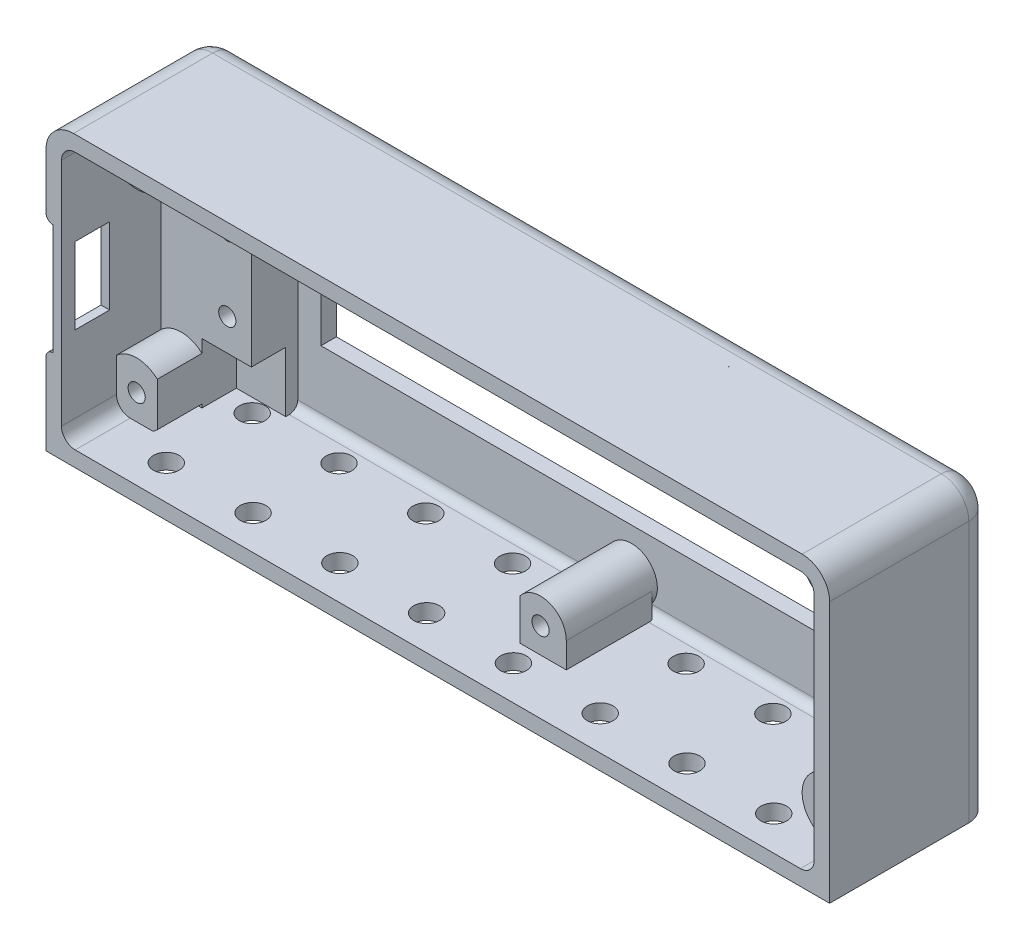
from build123d import *
from build123d.topology import SkipClean

# Parameters (mm, degrees)
SKETCH_2_W             = 87.6
SKETCH_2_H             = 30
SKETCH_2_W_2           = 61.2
SKETCH_2_H_2           = 14.6
EXTRUDE_1_DEPTH        = 1.8
EXTRUDE_1_2_DEPTH      = 17
EXTRUDE_1_2_DEPTH_BACK = 1.8
SKETCH_3_W             = 91.2
SKETCH_3_H             = 33.6
SKETCH_3_W_2           = 87.6
SKETCH_3_H_2           = 30
SKETCH_4_W             = 10.5
SKETCH_4_H             = 30
SKETCH_4_W_2           = 6.9
EXTRUDE_2_DEPTH        = 5.4
SKETCH_5_R             = 1
CUT_EXTRUDE_1_DEPTH    = 5.4
FILLET_2_R             = 1
FILLET_5_R             = 1.6
FILLET_6_R             = 3.2
FILLET_7_R             = 2.6
SKETCH_8_R             = 3
SKETCH_8_R_2           = 3.5
EXTRUDE_3_DEPTH        = 10.6
SKETCH_9_W             = 6
SKETCH_9_H             = 3.046171036
SKETCH_9_H_2           = 2.953828964
EXTRUDE_4_DEPTH        = 10
SKETCH_10_R            = 1
CUT_EXTRUDE_2_DEPTH    = 10.6
EXTRUDE_START          = 1.6
SKETCH_11_R            = 1
EXTRUDE_5_DEPTH        = 1.6
SKETCH_12_W            = 4
SKETCH_12_H            = 8.9
CUT_EXTRUDE_3_DEPTH    = 2
SKETCH_13_W            = 7.2
SKETCH_13_H            = 12.9
CUT_EXTRUDE_4_DEPTH    = 0.8
FILLET_8_R             = 0.8
SKETCH_14_W            = 42.2
SKETCH_14_H            = 7
CUT_EXTRUDE_5_DEPTH    = 10.8
SKETCH_15_W            = 3
SKETCH_15_H            = 16.8
EXTRUDE_6_DEPTH        = 2
CHAMFER_START          = -44.4
CHAMFER_2_DEPTH        = 85.2
CHAMFER_2_2_DEPTH      = 3
CHAMFER_START_2        = 37.8
CHAMFER_2_3_DEPTH      = 3
SKETCH_16_R            = 1.5
CUT_EXTRUDE_6_DEPTH    = 1.8


with BuildPart() as part:
    # Эскиз2 → Extrude 1 (new body)
    with BuildSketch(Plane.XY):
        with Locations((-1.8, 0)):
            Rectangle(SKETCH_2_W, SKETCH_2_H)
        with Locations((-1.8, 0.1)):
            Rectangle(SKETCH_2_W_2, SKETCH_2_H_2, mode=Mode.SUBTRACT)
    extrude(amount=EXTRUDE_1_DEPTH)

    # Эскиз3 → Extrude 1 2 (add, two sides: drawn at the far end of the back side and taken through both)
    with BuildSketch(Plane.XY.offset(1.8).offset(-EXTRUDE_1_2_DEPTH_BACK)):
        with Locations((-1.8, 0)):
            Rectangle(SKETCH_3_W, SKETCH_3_H)
        with Locations((-1.8, 0)):
            Rectangle(SKETCH_3_W_2, SKETCH_3_H_2, mode=Mode.SUBTRACT)
    extrude(amount=EXTRUDE_1_2_DEPTH + EXTRUDE_1_2_DEPTH_BACK)

    # Эскиз4 → Бобышка-Вытянуть2 (add)
    with BuildSketch(Plane.XY.offset(1.8)):
        with Locations((-40.35, 0)):
            Rectangle(SKETCH_4_W, SKETCH_4_H)
        with Locations((38.55, 0)):
            Rectangle(SKETCH_4_W_2, SKETCH_4_H)
    extrude(amount=EXTRUDE_2_DEPTH)

    # Эскиз5 → Вырез-Вытянуть1 (cut)
    with BuildSketch(Plane.XY.offset(7.2)):
        with Locations((-37.9, 4.3)):
            Circle(SKETCH_5_R)
        with Locations((-37.9, -4.3)):
            Circle(SKETCH_5_R)
        with Locations((37.9, 4.3)):
            Circle(SKETCH_5_R)
        with Locations((37.9, -4.3)):
            Circle(SKETCH_5_R)
    extrude(amount=-CUT_EXTRUDE_1_DEPTH, mode=Mode.SUBTRACT)

    # Скругление2
    fillet_2_edges = [part.edges().sort_by_distance(p)[0] for p in [
        (0, -15, 1.8),
        (0, 15, 1.8),
    ]]
    fillet(fillet_2_edges, radius=FILLET_2_R)

    # Скругление5
    fillet_5_edges = [part.edges().sort_by_distance(p)[0] for p in [
        (-45.6, 15, 13),
        (-45.6, -15, 13),
        (42, -15, 13),
        (42, 15, 13),
    ]]
    fillet(fillet_5_edges, radius=FILLET_5_R)

    # Скругление6
    fillet_6_edges = [part.edges().sort_by_distance(p)[0] for p in [
        (-47.4, 16.8, 9.4),
        (43.8, 16.8, 9.4),
    ]]
    fillet(fillet_6_edges, radius=FILLET_6_R)

    # Скругление7
    fillet_7_edges = [part.edges().sort_by_distance(p)[0] for p in [
        (-1.8, 16.8, 0),
        (-47.4, -1.6, 0),
        (42.8627417, 15.8627417, 0),
        (-46.4627417, 15.8627417, 0),
        (43.8, -1.6, 0),
    ]]
    fillet(fillet_7_edges, radius=FILLET_7_R)

    # Эскиз8 → Бобышка-Вытянуть3 (add)
    with BuildSketch(Plane.XY.offset(1.8)):
        with Locations(Location((3.75345012, 11.953828964, 0), (0, 0, 136.995404907))):
            Circle(SKETCH_8_R)
        with Locations((3.75345012, -12.046171036)):
            Circle(SKETCH_8_R)
        with Locations((-43.24654988, 11.953828964)):
            Circle(SKETCH_8_R_2)
        with Locations((-43.24654988, -12.046171036)):
            Circle(SKETCH_8_R_2)
        with Locations((39.3, 11.953828964)):
            Circle(SKETCH_8_R_2)
        with Locations((39.3, -12.046171036)):
            Circle(SKETCH_8_R_2)
    extrude(amount=EXTRUDE_3_DEPTH)

    # Эскиз9 → Бобышка-Вытянуть4 (add)
    with BuildSketch(Plane.XY.offset(12.4)):
        with Locations((3.75345012, 13.476914482)):
            Rectangle(SKETCH_9_W, SKETCH_9_H)
        with Locations((3.75345012, -13.523085518)):
            Rectangle(SKETCH_9_W, SKETCH_9_H_2)
    extrude(amount=-EXTRUDE_4_DEPTH)

    # Эскиз10 → Вырез-Вытянуть2 (cut)
    with BuildSketch(Plane.XY.offset(12.4)):
        with Locations((3.75345012, 11.953828964)):
            Circle(SKETCH_10_R)
        with Locations((3.75345012, -12.046171036)):
            Circle(SKETCH_10_R)
        with Locations((-43.24654988, 11.953828964)):
            Circle(SKETCH_10_R)
        with Locations((-43.24654988, -12.046171036)):
            Circle(SKETCH_10_R)
        with Locations((39.3, 11.953828964)):
            Circle(SKETCH_10_R)
        with Locations((39.3, -12.046171036)):
            Circle(SKETCH_10_R)
    extrude(amount=-CUT_EXTRUDE_2_DEPTH, mode=Mode.SUBTRACT)

    # Эскиз11 → Бобышка-Вытянуть5 (add)
    # profile 1 of 2: a face of its own
    with SkipClean():  # the faces are left unmerged after this step: merging them gives an invalid solid
        with BuildSketch(Plane.XY.offset(12.4).offset(EXTRUDE_START)):
            with BuildLine():
                Line((40.4, 15), (37.576386929, 15))
                ThreePointArc((37.576386929, 15), (36.618546129, 9.704427902), (42, 9.726723219))
                Line((42, 9.726723219), (42, 13.4))
                ThreePointArc((42, 13.4), (41.53137085, 14.53137085), (40.4, 15))
            make_face()
            with Locations((39.3, 11.953828964)):
                Circle(SKETCH_11_R, mode=Mode.SUBTRACT)
        # profile 2 of 2: a face of its own
        with BuildSketch(Plane.XY.offset(12.4).offset(EXTRUDE_START)):
            with BuildLine():
                Line((42, -13.4), (42, -9.819065291))
                ThreePointArc((42, -9.819065291), (36.677089418, -9.728771615), (37.422529773, -15))
                Line((37.422529773, -15), (40.4, -15))
                ThreePointArc((40.4, -15), (41.53137085, -14.53137085), (42, -13.4))
            make_face()
            with Locations((39.3, -12.046171036)):
                Circle(SKETCH_11_R, mode=Mode.SUBTRACT)
        extrude(amount=-EXTRUDE_5_DEPTH)

    # Эскиз12 → Вырез-Вытянуть3 (cut)
    with SkipClean():  # the faces are left unmerged after this step: merging them gives an invalid solid
        with BuildSketch(Plane.ZY.offset(47.4)):
            with Locations((15.2, -0.046171036)):
                Rectangle(SKETCH_12_W, SKETCH_12_H)
        extrude(amount=-CUT_EXTRUDE_3_DEPTH, mode=Mode.SUBTRACT)

    # Эскиз13 → Вырез-Вытянуть4 (cut)
    with SkipClean():  # the faces are left unmerged after this step: merging them gives an invalid solid
        with BuildSketch(Plane.ZY.offset(47.4)):
            with Locations((15.2, -0.046171036)):
                Rectangle(SKETCH_13_W, SKETCH_13_H)
        extrude(amount=-CUT_EXTRUDE_4_DEPTH, mode=Mode.SUBTRACT)

    # Скругление8
    fillet_8_edges = [part.edges().sort_by_distance(p)[0] for p in [
        (-47.4, 6.403828964, 15.2),
        (-47.4, -0.046171036, 11.6),
        (-47.4, -6.496171036, 15.2),
    ]]
    fillet(fillet_8_edges, radius=FILLET_8_R - 0.0001)  # a hair under: the kernel refuses the full size

    # Эскиз14 → Вырез-Вытянуть5 (cut)
    with SkipClean():  # the faces are left unmerged after this step: merging them gives an invalid solid
        with BuildSketch(Plane.XY.offset(14)):
            with Locations((-19.74654988, 11.5)):
                Rectangle(SKETCH_14_W, SKETCH_14_H)
            with Locations((-19.74654988, -11.5)):
                Rectangle(SKETCH_14_W, SKETCH_14_H)
        extrude(amount=-CUT_EXTRUDE_5_DEPTH, mode=Mode.SUBTRACT)

    # Эскиз15 → Бобышка-Вытянуть6 (add)
    with SkipClean():  # the faces are left unmerged after this step: merging them gives an invalid solid
        with BuildSketch(Plane.XZ.offset(16.8)):
            with Locations((-42.9, 10.4)):
                Rectangle(SKETCH_15_W, SKETCH_15_H)
            with Locations((39.3, 10.4)):
                Rectangle(SKETCH_15_W, SKETCH_15_H)
        extrude(amount=EXTRUDE_6_DEPTH)

    # Фаска2: read off the stored shape, not the designer's step
    # Фаска2 outline → Фаска2 (cut)
    with SkipClean():  # the faces are left unmerged after this step: merging them gives an invalid solid
        with BuildSketch(Plane.YZ.offset(CHAMFER_START)):
            Polygon((-18.8, 18.8), (-18.8, 16.8), (-16.8, 18.8), align=None)
        extrude(amount=CHAMFER_2_DEPTH, mode=Mode.SUBTRACT)

    # Chamfer 2 2 outline → Chamfer 2 2 (add)
    with SkipClean():  # the faces are left unmerged after this step: merging them gives an invalid solid
        with BuildSketch(Plane.YZ.offset(CHAMFER_START)):
            Polygon((-16.8, 2), (-18.8, 2), (-16.8, 0), align=None)
        extrude(amount=CHAMFER_2_2_DEPTH)

    # Chamfer 2 3 outline → Chamfer 2 3 (add)
    with SkipClean():  # the faces are left unmerged after this step: merging them gives an invalid solid
        with BuildSketch(Plane.YZ.offset(CHAMFER_START_2)):
            Polygon((-16.8, 2), (-18.8, 2), (-16.8, 0), align=None)
        extrude(amount=CHAMFER_2_3_DEPTH)

    # Эскиз16 → Вырез-Вытянуть6 (cut)
    with SkipClean():  # the faces are left unmerged after this step: merging them gives an invalid solid
        with BuildSketch(Plane.XZ.offset(16.8)):
            with Locations(Location((-37.4, 14.8, 0), (0, 0, 270))):
                Circle(SKETCH_16_R)
            with Locations(Location((-27.3, 14.8, 0), (0, 0, 270))):
                Circle(SKETCH_16_R)
            with Locations(Location((-17.2, 14.8, 0), (0, 0, 270))):
                Circle(SKETCH_16_R)
            with Locations(Location((-7.1, 14.8, 0), (0, 0, 270))):
                Circle(SKETCH_16_R)
            with Locations(Location((3, 14.8, 0), (0, 0, 270))):
                Circle(SKETCH_16_R)
            with Locations(Location((13.1, 14.8, 0), (0, 0, 270))):
                Circle(SKETCH_16_R)
            with Locations(Location((23.2, 14.8, 0), (0, 0, 270))):
                Circle(SKETCH_16_R)
            with Locations(Location((33.3, 14.8, 0), (0, 0, 270))):
                Circle(SKETCH_16_R)
            with Locations(Location((-27.3, 4.8, 0), (0, 0, 270))):
                Circle(SKETCH_16_R)
            with Locations(Location((-17.2, 4.8, 0), (0, 0, 270))):
                Circle(SKETCH_16_R)
            with Locations(Location((-7.1, 4.8, 0), (0, 0, 270))):
                Circle(SKETCH_16_R)
            with Locations(Location((3, 4.8, 0), (0, 0, 270))):
                Circle(SKETCH_16_R)
            with Locations(Location((13.1, 4.8, 0), (0, 0, 270))):
                Circle(SKETCH_16_R)
            with Locations(Location((23.2, 4.8, 0), (0, 0, 270))):
                Circle(SKETCH_16_R)
            with Locations(Location((33.3, 4.8, 0), (0, 0, 270))):
                Circle(SKETCH_16_R)
            with Locations(Location((-37.4, 4.8, 0), (0, 0, 270))):
                Circle(SKETCH_16_R)
        extrude(amount=-CUT_EXTRUDE_6_DEPTH, mode=Mode.SUBTRACT)


solid = part.part
